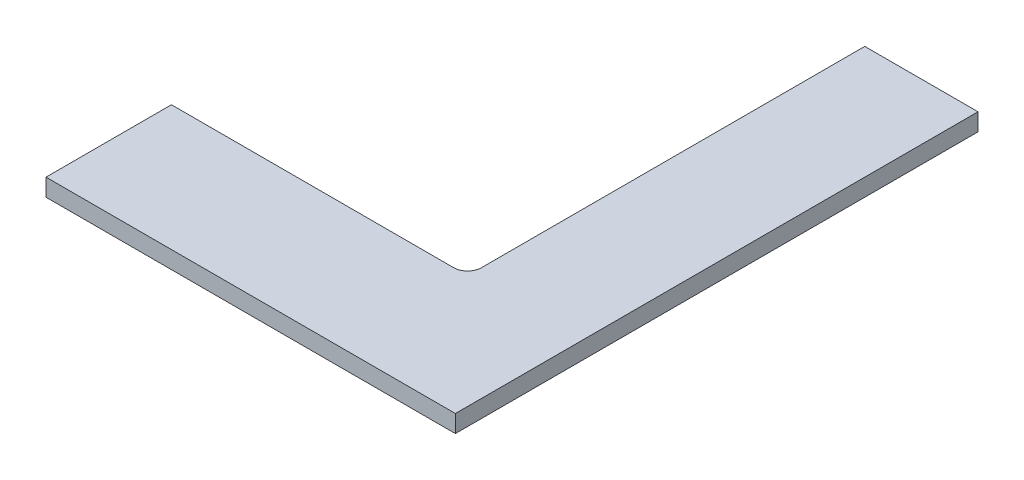
from build123d import *

# Parameters (mm, degrees)
SKETCH_1_W      = 65
SKETCH_1_H      = 300
EXTRUDE_1_DEPTH = 10
SKETCH_2_W      = 72
SKETCH_2_H      = 10
EXTRUDE_2_DEPTH = 170
FILLET_8_R      = 8


with BuildPart() as part:
    # 草图1 → 凸台-拉伸1 (new body)
    with BuildSketch(Plane(origin=(0, 0, 0), x_dir=(1, 0, 0), z_dir=(0, 1, 0))):
        with Locations((32.5, -150)):
            Rectangle(SKETCH_1_W, SKETCH_1_H)
    extrude(amount=EXTRUDE_1_DEPTH)

    # 草图2 → 凸台-拉伸2 (add)
    with BuildSketch(Plane.ZY):
        with Locations((264, 5)):
            Rectangle(SKETCH_2_W, SKETCH_2_H)
    extrude(amount=EXTRUDE_2_DEPTH)

    # 圆角8
    fillet_8_edges = [part.edges().sort_by_distance(p)[0] for p in [
        (0, 5, 228),
    ]]
    fillet(fillet_8_edges, radius=FILLET_8_R)


solid = part.part
